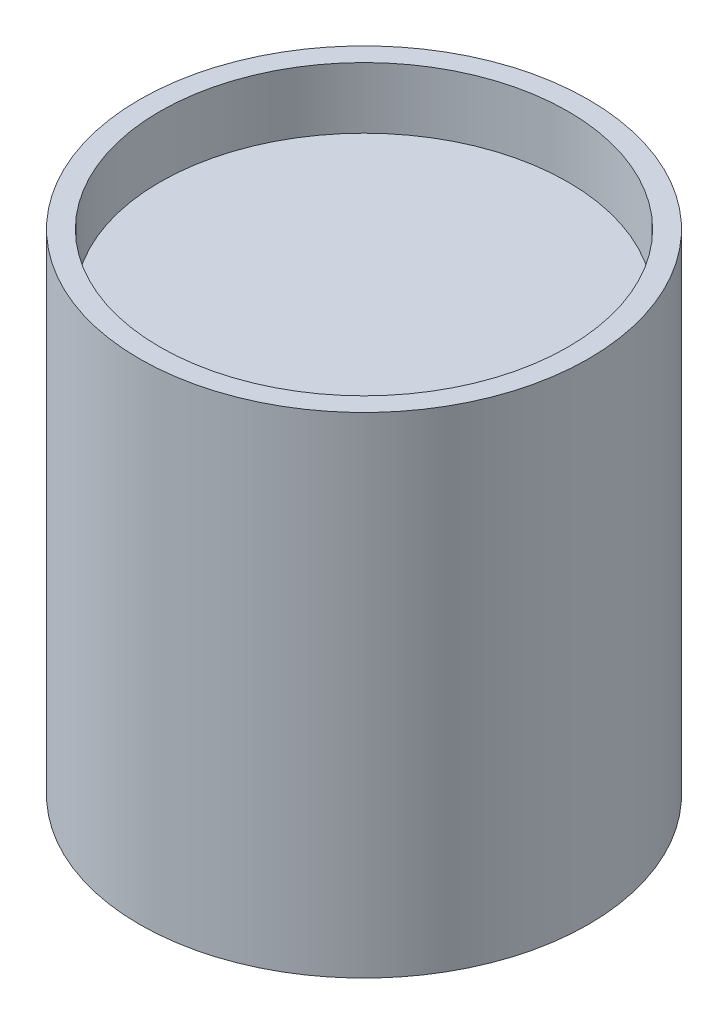
from build123d import *

# Parameters (mm, degrees)
SKETCH2_W = 31.7246
SKETCH2_H = 63.5


with BuildPart() as part:
    # Sketch1 → Revolve1 (revolve)
    with BuildSketch(Plane.XY):
        Polygon((31.75, 76.2), (31.75, 3.175), (0, 3.175), (0, 0), (34.925, 0), (34.925, 76.2), align=None)
    revolve(axis=Axis((0, -1000, 0), (0, 1, 0)))


with BuildPart() as body_2:
    # Sketch2 → Revolve2 (revolve)
    with BuildSketch(Plane.XY):
        with Locations((15.8623, 34.9504)):
            Rectangle(SKETCH2_W, SKETCH2_H)
    revolve(axis=Axis((0, 66.7004, 0), (0, -1, 0)))


solid = Compound([part.part, body_2.part])
